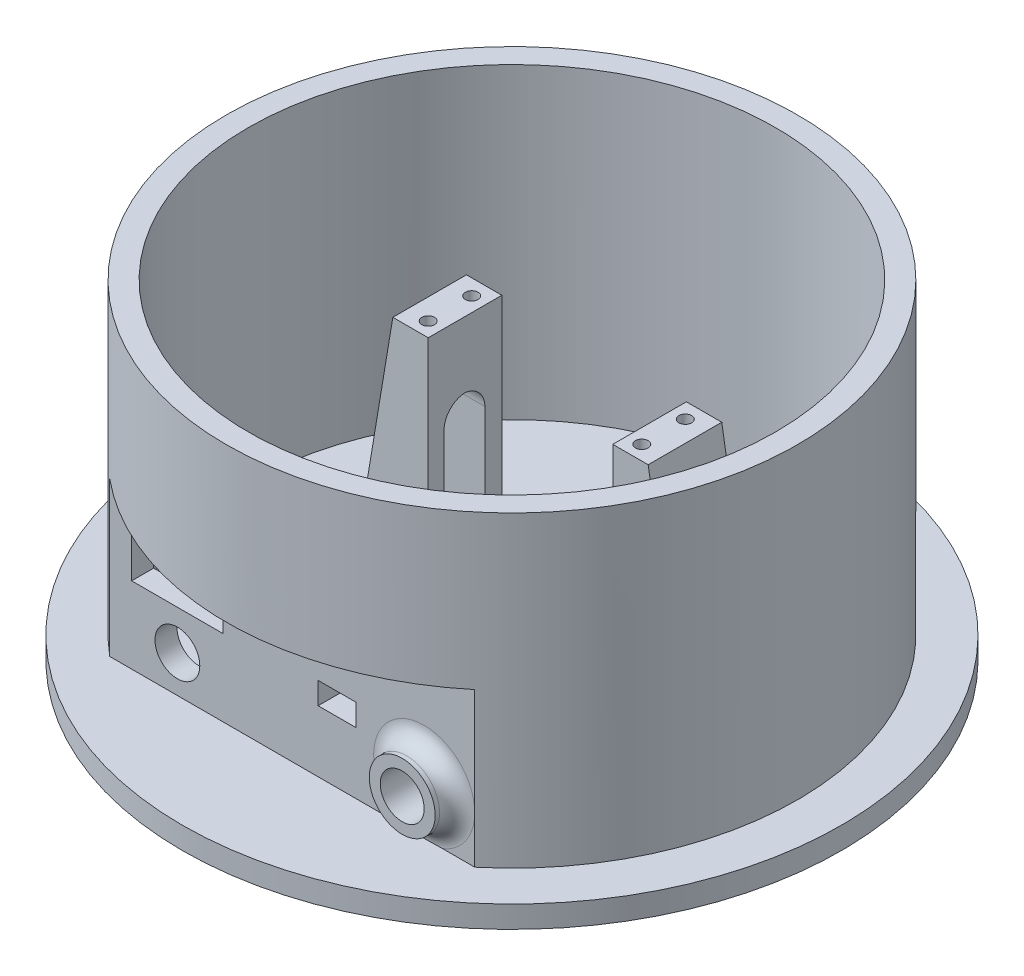
from build123d import *

# Parameters (mm, degrees)
SKETCH4_R                   = 65
SKETCH4_R_2                 = 60
EXTRUDE_THIN1_DEPTH         = 75
SKETCH5_R                   = 75
BOSS_EXTRUDE1_DEPTH         = 5
BOSS_EXTRUDE2_START         = -40
SKETCH6_W                   = 83.06623863
SKETCH6_H                   = 5
BOSS_EXTRUDE2_DEPTH         = 40
CUT_EXTRUDE1_START          = -40
CUT_EXTRUDE1_DEPTH          = 35
SKETCH8_W                   = 7.6
SKETCH8_H                   = 16.75
BOSS_EXTRUDE3_DEPTH         = 57.3
CHAMFER1_SIZE               = 10
CHAMFER1_SIZE_2             = 60
M3_5X0_6_TAPPED_HOLE1_D     = 2.9
M3_5X0_6_TAPPED_HOLE1_DEPTH = 9.128752102
M3_5X0_6_TAPPED_HOLE1_TIP   = 0.871247898
CUT_EXTRUDE2_START          = -57.3
SKETCH11_W                  = 18.622960368
SKETCH11_H                  = 9.279079534
CUT_EXTRUDE2_DEPTH          = 42.3
FILLET1_R                   = 5
CUT_EXTRUDE3_REACH          = 165.936
SKETCH12_R                  = 5.1
SKETCH12_W                  = 20.8
SKETCH12_H                  = 12.6
SKETCH12_W_2                = 8.6
SKETCH12_H_2                = 5
SKETCH13_R                  = 7.5
SKETCH13_R_2                = 5
BOSS_EXTRUDE4_DEPTH         = 5
FILLET2_R                   = 4
CUT_EXTRUDE4_REACH          = 165.936
SKETCH14_R                  = 5


with BuildPart() as part:
    # Sketch4 → Extrude-Thin1 (new body)
    with BuildSketch(Plane(origin=(0, 0, 0), x_dir=(1, 0, 0), z_dir=(0, 1, 0))):
        Circle(SKETCH4_R)
        Circle(SKETCH4_R_2, mode=Mode.SUBTRACT)
    extrude(amount=EXTRUDE_THIN1_DEPTH)

    # Sketch5 → Boss-Extrude1 (add)
    with BuildSketch(Plane(origin=(0, 0, 0), x_dir=(1, 0, 0), z_dir=(0, 1, 0))):
        with Locations(Location((0, 0, 0), (0, 0, 270))):
            Circle(SKETCH5_R)
    extrude(amount=BOSS_EXTRUDE1_DEPTH)

    # Sketch6 → Boss-Extrude2 (add)
    with BuildSketch(Plane(origin=(0, 45, 0), x_dir=(1, 0, 0), z_dir=(0, 1, 0)).offset(BOSS_EXTRUDE2_START)):
        with Locations((0, -47.5)):
            Rectangle(SKETCH6_W, SKETCH6_H)
        with BuildLine():
            Line((41.533119315, -50), (0, -50))
            Line((0, -50), (0, -65))
            ThreePointArc((0, -65), (22.079402166, -61.135096303), (41.533119315, -50))
        make_face()
        with BuildLine():
            Line((0, -65), (0, -50))
            Line((0, -50), (-41.533119315, -50))
            ThreePointArc((-41.533119315, -50), (-22.079402166, -61.135096303), (0, -65))
        make_face()
        with BuildLine():
            Line((41.533119315, -50), (0, -50))
            Line((0, -50), (0, -65))
            ThreePointArc((0, -65), (22.079402166, -61.135096303), (41.533119315, -50))
        make_face()
        with BuildLine():
            Line((0, -65), (0, -50))
            Line((0, -50), (-41.533119315, -50))
            ThreePointArc((-41.533119315, -50), (-22.079402166, -61.135096303), (0, -65))
        make_face()
    extrude(amount=BOSS_EXTRUDE2_DEPTH)

    # Sketch7 → Cut-Extrude1 (cut)
    with BuildSketch(Plane(origin=(0, 45, 0), x_dir=(1, 0, 0), z_dir=(0, 1, 0)).offset(CUT_EXTRUDE1_START)):
        with BuildLine():
            Line((-41.533119315, -50), (41.533119315, -50))
            ThreePointArc((41.533119315, -50), (0, -65), (-41.533119315, -50))
        make_face()
    extrude(amount=CUT_EXTRUDE1_DEPTH, mode=Mode.SUBTRACT)

    # Sketch8 → Boss-Extrude3 (add)
    with BuildSketch(Plane(origin=(0, 5, 0), x_dir=(1, 0, 0), z_dir=(0, 1, 0))):
        with Locations((35, 0.125)):
            Rectangle(SKETCH8_W, SKETCH8_H)
        with Locations((-14.6, 0.125)):
            Rectangle(SKETCH8_W, SKETCH8_H)
    extrude(amount=BOSS_EXTRUDE3_DEPTH)

    # Chamfer1
    # the kernel refuses this chamfer: 60, 10 mm, written as the material it adds along each edge
    with BuildSketch(Plane(origin=(38.8, 5, -8.5), x_dir=(0.9750324932942595, -0.2220622368174739, 0), z_dir=(0, 0, 1))) as chamfer1_piece_1_section:
        Polygon((CHAMFER1_SIZE * 0.975032493294, CHAMFER1_SIZE * 0.222062236817), (-CHAMFER1_SIZE_2 * 0.222062236817, CHAMFER1_SIZE_2 * 0.975032493294), (0, 0), align=None)
    chamfer1_piece_1 = extrude(amount=16.75, mode=Mode.PRIVATE)
    chamfer1_piece_1 = split(chamfer1_piece_1, bisect_by=Plane(origin=(41.528502242, 62.3, -0.125), z_dir=(0, -1, 0)), keep=Keep.TOP, mode=Mode.PRIVATE)
    add(chamfer1_piece_1)
    with BuildSketch(Plane(origin=(-18.4, 5, -8.5), x_dir=(-0.9750324932942595, -0.2220622368174739, 0), z_dir=(0, 0, 1))) as chamfer1_piece_2_section:
        Polygon((CHAMFER1_SIZE * 0.975032493294, -CHAMFER1_SIZE * 0.222062236817), (-CHAMFER1_SIZE_2 * 0.222062236817, -CHAMFER1_SIZE_2 * 0.975032493294), (0, 0), align=None)
    chamfer1_piece_2 = extrude(amount=16.75, mode=Mode.PRIVATE)
    chamfer1_piece_2 = split(chamfer1_piece_2, bisect_by=Plane(origin=(-21.128502242, 62.3, -0.125), z_dir=(0, -1, 0)), keep=Keep.TOP, mode=Mode.PRIVATE)
    add(chamfer1_piece_2)

    # M3.5x0.6 Tapped Hole1
    with Locations(Plane(origin=(0, 62.3, 0), x_dir=(1, 0, 0), z_dir=(0, 1, 0))):
        with Locations((34.5, 4.95), (34.5, -4.95), (-14.1, 4.95), (-14.1, -4.95)):
            Hole(M3_5X0_6_TAPPED_HOLE1_D / 2, depth=M3_5X0_6_TAPPED_HOLE1_DEPTH)
            with Locations((0, 0, -(M3_5X0_6_TAPPED_HOLE1_DEPTH + M3_5X0_6_TAPPED_HOLE1_TIP / 2))):  # 118° drill point
                Cone(0, M3_5X0_6_TAPPED_HOLE1_D / 2, M3_5X0_6_TAPPED_HOLE1_TIP, mode=Mode.SUBTRACT)

    # Sketch11 → Cut-Extrude2 (cut)
    with BuildSketch(Plane(origin=(0, 62.3, 0), x_dir=(1, 0, 0), z_dir=(0, 1, 0)).offset(CUT_EXTRUDE2_START)):
        with Locations((-19.088519816, 0)):
            Rectangle(SKETCH11_W, SKETCH11_H)
    extrude(amount=CUT_EXTRUDE2_DEPTH, mode=Mode.SUBTRACT)

    # Fillet1
    # the kernel refuses this fillet: 5 mm, written as the material it adds along each edge
    with BuildSketch(Plane(origin=(-10.8, 47.3, -4.639539767), x_dir=(0, 0, 1), z_dir=(-1, 0, 0))) as fillet1_piece_1_section:
        with BuildLine():
            CenterArc((FILLET1_R, -FILLET1_R), FILLET1_R, 90, 90)
            Line((0, -FILLET1_R), (0, 0))
            Line((0, 0), (FILLET1_R, 0))
        make_face()
    fillet1_piece_1 = extrude(amount=23.05, mode=Mode.PRIVATE)
    fillet1_piece_1 = split(fillet1_piece_1, bisect_by=Plane(origin=(-21.396510454, 47.020937275, -3.518217567), z_dir=(0.9863939238321439, -0.1643989873053573, 0)), keep=Keep.TOP, mode=Mode.PRIVATE)
    add(fillet1_piece_1)
    with BuildSketch(Plane(origin=(-33.85, 47.3, 4.639539767), x_dir=(0, -1, 0), z_dir=(1, 0, 0))) as fillet1_piece_2_section:
        with BuildLine():
            CenterArc((FILLET1_R, FILLET1_R), FILLET1_R, 180, 90)
            Line((0, FILLET1_R), (0, 0))
            Line((0, 0), (FILLET1_R, 0))
        make_face()
    fillet1_piece_2 = extrude(amount=23.05, mode=Mode.PRIVATE)
    fillet1_piece_2 = split(fillet1_piece_2, bisect_by=Plane(origin=(-21.396510454, 47.020937275, 3.518217567), z_dir=(0.9863939238321439, -0.1643989873053573, 0)), keep=Keep.TOP, mode=Mode.PRIVATE)
    add(fillet1_piece_2)

    # Sketch12 → Cut-Extrude3 (cut, up to next)
    with BuildSketch(Plane.XY.offset(50), mode=Mode.PRIVATE) as cut_extrude3_sk1:
        with Locations((-26.133119315, 13.4)):
            Circle(SKETCH12_R)
    cut_extrude3_tool1 = extrude(cut_extrude3_sk1.sketch, amount=-CUT_EXTRUDE3_REACH, mode=Mode.PRIVATE) & part.part
    # Sketch12 → Cut-Extrude3 (cut, up to next)
    with BuildSketch(Plane.XY.offset(50), mode=Mode.PRIVATE) as cut_extrude3_sk2:
        with Locations((-26.133119315, 28.7)):
            Rectangle(SKETCH12_W, SKETCH12_H)
    cut_extrude3_tool2 = extrude(cut_extrude3_sk2.sketch, amount=-CUT_EXTRUDE3_REACH, mode=Mode.PRIVATE) & part.part
    # Sketch12 → Cut-Extrude3 (cut, up to next)
    with BuildSketch(Plane.XY.offset(50), mode=Mode.PRIVATE) as cut_extrude3_sk3:
        with Locations((10.2, 21.5)):
            Rectangle(SKETCH12_W_2, SKETCH12_H_2)
    cut_extrude3_tool3 = extrude(cut_extrude3_sk3.sketch, amount=-CUT_EXTRUDE3_REACH, mode=Mode.PRIVATE) & part.part
    add(cut_extrude3_tool1.solids().sort_by_distance((-26.133119, 13.4, 50))[0], mode=Mode.SUBTRACT)
    add(cut_extrude3_tool2.solids().sort_by_distance((-26.133119, 28.7, 50))[0], mode=Mode.SUBTRACT)
    add(cut_extrude3_tool3.solids().sort_by_distance((10.2, 21.5, 50))[0], mode=Mode.SUBTRACT)

    # Sketch13 → Boss-Extrude4 (add)
    with BuildSketch(Plane.XY.offset(50)):
        with Locations(Location((30.033119315, 15.715961892, 0), (0, 0, 180))):
            Circle(SKETCH13_R)
        with Locations((30.033119315, 15.715961892)):
            Circle(SKETCH13_R_2, mode=Mode.SUBTRACT)
    extrude(amount=BOSS_EXTRUDE4_DEPTH)

    # Fillet2
    # the kernel refuses this fillet: 4 mm, written as the material it adds along each edge
    with BuildSketch(Plane(origin=(30.033119315, 15.715961892, 50), x_dir=(-1, 0, 0), z_dir=(0, 1, 0))) as fillet2_piece_1:
        with BuildLine():
            CenterArc((7.5 + FILLET2_R, FILLET2_R), FILLET2_R, 180, 90)
            Line((7.5, FILLET2_R), (7.5, 0))
            Line((7.5, 0), (7.5 + FILLET2_R, 0))
        make_face()
    revolve(axis=Axis((30.033119315, 15.715961892, 50), (0, 0, 1)))

    # Sketch14 → Cut-Extrude4 (cut, up to next)
    with BuildSketch(Plane.XY.offset(50), mode=Mode.PRIVATE) as cut_extrude4_sk1:
        with Locations((30.033119315, 15.715961892)):
            Circle(SKETCH14_R)
    cut_extrude4_tool1 = extrude(cut_extrude4_sk1.sketch, amount=-CUT_EXTRUDE4_REACH, mode=Mode.PRIVATE) & part.part
    add(cut_extrude4_tool1.solids().sort_by_distance((30.033119, 15.715962, 50))[0], mode=Mode.SUBTRACT)


solid = part.part
